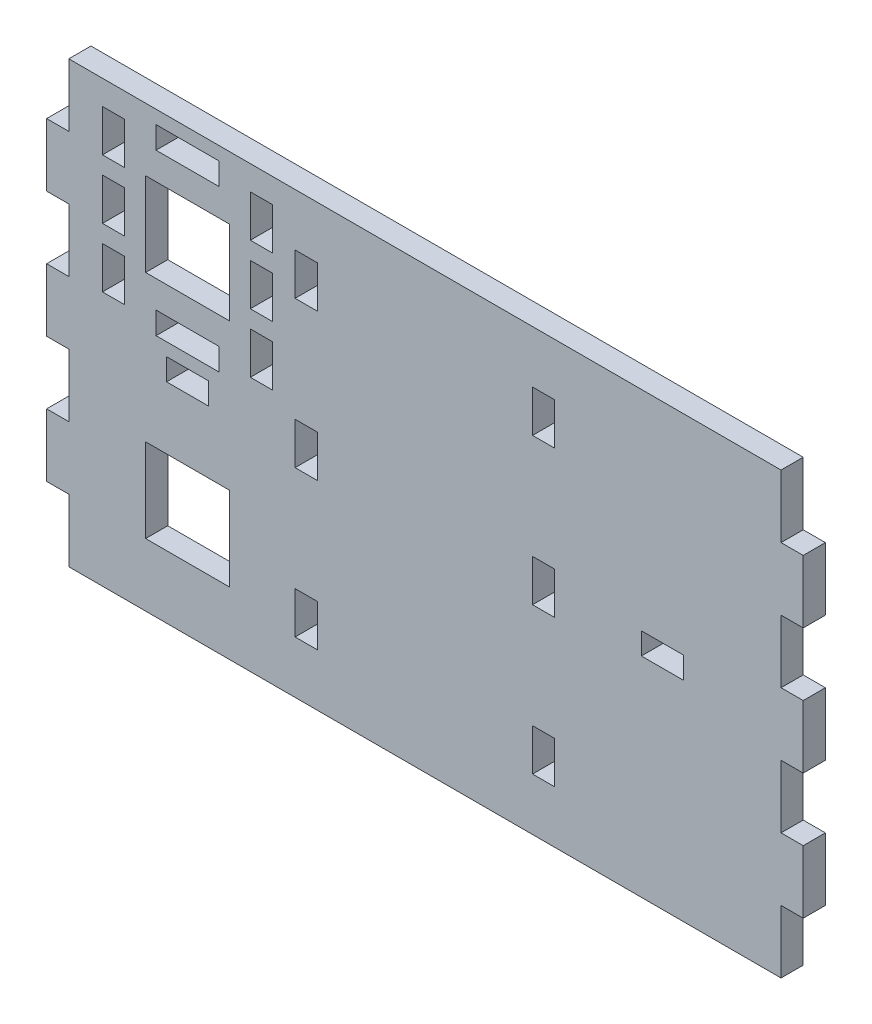
from build123d import *

# Parameters (mm, degrees)
SKETCH1_W           = 12
SKETCH1_H           = 12
SKETCH1_W_2         = 6
SKETCH1_H_2         = 3.125
SKETCH1_W_3         = 9
SKETCH1_H_3         = 3.175
SKETCH1_W_4         = 3.175
SKETCH1_H_4         = 6
BOSS_EXTRUDE1_DEPTH = 1.5875


with BuildPart() as part:
    # Sketch1 → Boss-Extrude1 (new, symmetric)
    with BuildSketch(Plane.XY):
        Polygon((54.175, 0), (54.175, 4.5), (51, 4.5), (51, 13.5), (54.175, 13.5), (54.175, 22.5), (51, 22.5), (51, 31.5), (-51, 31.5), (-51, 22.5), (-54.175, 22.5), (-54.175, 13.5), (-51, 13.5), (-51, 4.5), (-54.175, 4.5), (-54.175, -4.5), (-51, -4.5), (-51, -13.5), (-54.175, -13.5), (-54.175, -22.5), (-51, -22.5), (-51, -31.5), (51, -31.5), (51, -22.5), (54.175, -22.5), (54.175, -13.5), (51, -13.5), (51, -4.5), (54.175, -4.5), align=None)
        with Locations((-34, -16.5)):
            Rectangle(SKETCH1_W, SKETCH1_H, mode=Mode.SUBTRACT)
        with Locations((-34, 0)):
            Rectangle(SKETCH1_W_2, SKETCH1_H_2, mode=Mode.SUBTRACT)
        with Locations((-34, 5)):
            Rectangle(SKETCH1_W_3, SKETCH1_H_3, mode=Mode.SUBTRACT)
        with Locations((-34, 16.5)):
            Rectangle(SKETCH1_W, SKETCH1_H, mode=Mode.SUBTRACT)
        with Locations((-34, 28)):
            Rectangle(SKETCH1_W_3, SKETCH1_H_3, mode=Mode.SUBTRACT)
        with Locations((-17, -21)):
            Rectangle(SKETCH1_W_4, SKETCH1_H_4, mode=Mode.SUBTRACT)
        with Locations((17, -21)):
            Rectangle(SKETCH1_W_4, SKETCH1_H_4, mode=Mode.SUBTRACT)
        with Locations((-17, 0)):
            Rectangle(SKETCH1_W_4, SKETCH1_H_4, mode=Mode.SUBTRACT)
        with Locations((-23.4125, 8)):
            Rectangle(SKETCH1_W_4, SKETCH1_H_4, mode=Mode.SUBTRACT)
        with Locations((-23.4125, 16.5)):
            Rectangle(SKETCH1_W_4, SKETCH1_H_4, mode=Mode.SUBTRACT)
        with Locations((-17, 21)):
            Rectangle(SKETCH1_W_4, SKETCH1_H_4, mode=Mode.SUBTRACT)
        with Locations((-23.4125, 25)):
            Rectangle(SKETCH1_W_4, SKETCH1_H_4, mode=Mode.SUBTRACT)
        with Locations((17, 0)):
            Rectangle(SKETCH1_W_4, SKETCH1_H_4, mode=Mode.SUBTRACT)
        Polygon((37, 1.5625), (37, 0), (37, -1.5625), (31, -1.5625), (31, 1.5625), align=None, mode=Mode.SUBTRACT)
        with Locations((17, 21)):
            Rectangle(SKETCH1_W_4, SKETCH1_H_4, mode=Mode.SUBTRACT)
        with Locations((-44.5875, 16.5)):
            Rectangle(SKETCH1_W_4, SKETCH1_H_4, mode=Mode.SUBTRACT)
        with Locations((-44.5875, 25)):
            Rectangle(SKETCH1_W_4, SKETCH1_H_4, mode=Mode.SUBTRACT)
        with Locations((-44.5875, 8)):
            Rectangle(SKETCH1_W_4, SKETCH1_H_4, mode=Mode.SUBTRACT)
    extrude(amount=BOSS_EXTRUDE1_DEPTH, both=True)


solid = part.part
